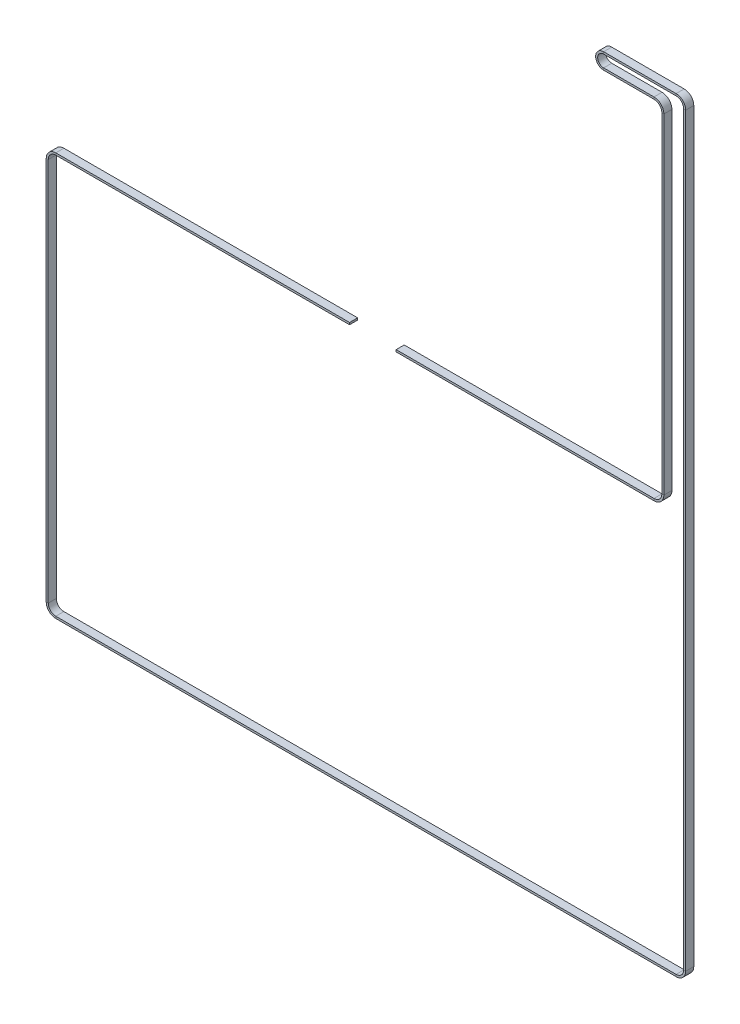
from build123d import *

# Parameters (mm, degrees)
SKETCH4_W = 6
SKETCH4_H = 1.5


with BuildPart() as part:
    # Sweep1: sweep along a path in Sketch1
    with BuildLine(Plane.XY.offset(2.2)) as sweep1_path:
        Line((188.090765611, -411.507267642), (-30.687774041, -411.507267642))
        ThreePointArc((-30.687774041, -411.507267642), (-35.195579771, -413.374461912), (-37.062774041, -417.882267642))
        Line((-37.062774041, -417.882267642), (-37.062774041, -703.985411885))
        ThreePointArc((-37.062774041, -703.985411885), (-35.195579771, -708.493217615), (-30.687774041, -710.360411885))
        Line((-30.687774041, -710.360411885), (431.312225959, -710.360411885))
        ThreePointArc((431.312225959, -710.360411885), (435.820031689, -708.493217615), (437.687225959, -703.985411885))
        Line((437.687225959, -703.985411885), (437.687225959, -148.660411885))
        ThreePointArc((437.687225959, -148.660411885), (435.820031689, -144.152606155), (431.312225959, -142.285411885))
        Line((431.312225959, -142.285411885), (377.312225959, -142.285411885))
        ThreePointArc((377.312225959, -142.285411885), (372.112225959, -147.485411885), (377.312225959, -152.685411885))
        Line((377.312225959, -152.685411885), (414.812225959, -152.685411885))
        ThreePointArc((414.812225959, -152.685411885), (419.479130714, -154.618507129), (421.412225959, -159.285411885))
        Line((421.412225959, -159.285411885), (421.412225959, -405.057267642))
        ThreePointArc((421.412225959, -405.057267642), (419.479130714, -409.724172398), (414.812225959, -411.657267642))
        Line((414.812225959, -411.657267642), (222.790765611, -411.657267642))
    # Sketch4 → Sweep1 (sweep)
    with BuildSketch(Plane(origin=(188.090765611, -411.507267642, 2.2), x_dir=(0, 0, -1), z_dir=(1, 0, 0))):
        Rectangle(SKETCH4_W, SKETCH4_H)
    sweep(path=sweep1_path.line)


solid = part.part
